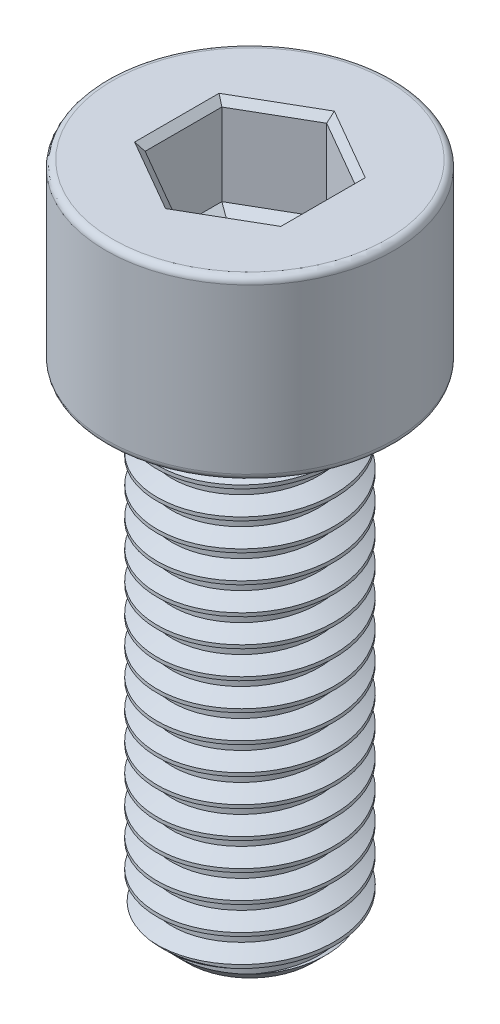
from build123d import *

# Parameters (mm, degrees)
SKETCH1_R           = 4
BOSS_EXTRUDE1_DEPTH = 22
THREAD1_PITCH       = 1.25
SKETCH2_R           = 6.5
BOSS_EXTRUDE2_DEPTH = 8
FILLET1_R           = 0.3
CUT_EXTRUDE1_DEPTH  = 4
CHAMFER1_SIZE       = 0.3
CUT_EXTRUDE2_DEPTH  = 0.4
CUT_EXTRUDE2_DRAFT  = -60


with BuildPart() as part:
    # Sketch1 → Boss-Extrude1 (new body)
    with BuildSketch(Plane(origin=(0, 0, 0), x_dir=(1, 0, 0), z_dir=(0, 1, 0))):
        with Locations(Location((0, 0, 0), (0, 0, 270))):
            Circle(SKETCH1_R)
    extrude(amount=BOSS_EXTRUDE1_DEPTH)

    # Thread1: the profile of Thread Profile1 profile screwed along a right-hand helix of 18.6 turns, 8 arcs to a turn; built about Z, then put on its axis
    thread1_z = Axis((0, 0, 0), (0, 0, 1))
    thread1_corners = [(4.0003, 0, -0.000173205), (4.0003, 0, 1.093923202), (3.323417656, 0, 0.703124998), (3.323417656, 0, 0.390624998)]
    with BuildLine(mode=Mode.PRIVATE) as thread1_profile:
        Line(thread1_corners[0], thread1_corners[1])
        Line(thread1_corners[1], thread1_corners[2])
        Line(thread1_corners[2], thread1_corners[3])
        Line(thread1_corners[3], thread1_corners[0])
    thread1_cap = Face(thread1_profile.wire())
    thread1_turn_angles = [0, 22.5, 45, 67.5, 90, 112.5, 135, 157.5, 180, 202.5, 225, 247.5, 270, 292.5, 315, 337.5, 360]
    thread1_turn_weights = [1, 0.9238795325112867, 1, 0.9238795325112867, 1, 0.9238795325112867, 1, 0.9238795325112867, 1, 0.9238795325112867, 1, 0.9238795325112867, 1, 0.9238795325112867, 1, 0.9238795325112867, 1]
    thread1_turn_rails = [Edge.make_bspline([Vector(p[0], p[1], 0).rotate(thread1_z, thread1_turn_angles[k]) / thread1_turn_weights[k] + Vector(0, 0, p[2] + THREAD1_PITCH * thread1_turn_angles[k] / 360) for k in range(17)], [0, 0, 0, 1, 1, 2, 2, 3, 3, 4, 4, 5, 5, 6, 6, 7, 7, 8, 8, 8], 2, thread1_turn_weights) for p in thread1_corners]
    thread1_turn_sides = [Face.make_surface_from_curves(thread1_turn_rails[p[0]], thread1_turn_rails[p[1]]) for p in [(0, 1), (1, 2), (2, 3), (3, 0)]]
    thread1_last_angles = [6480, 6502.5, 6525, 6547.5, 6570, 6592.5, 6615, 6637.5, 6660, 6678, 6696]
    thread1_last_weights = [1, 0.9238795325112867, 1, 0.9238795325112867, 1, 0.9238795325112867, 1, 0.9238795325112867, 1, 0.9510565162951535, 1]
    thread1_last_rails = [Edge.make_bspline([Vector(p[0], p[1], 0).rotate(thread1_z, thread1_last_angles[k]) / thread1_last_weights[k] + Vector(0, 0, p[2] + THREAD1_PITCH * thread1_last_angles[k] / 360) for k in range(11)], [0, 0, 0, 1, 1, 2, 2, 3, 3, 4, 4, 5, 5, 5], 2, thread1_last_weights) for p in thread1_corners]
    thread1_last_sides = [Face.make_surface_from_curves(thread1_last_rails[p[0]], thread1_last_rails[p[1]]) for p in [(0, 1), (1, 2), (2, 3), (3, 0)]]
    thread1 = Plane(origin=(0, 23.25, 0), x_dir=(-1, 0, 0), z_dir=(0, -1, 0)) * Solid(Shell([*[p.moved(Location((0, 0, THREAD1_PITCH * i))) for i in range(18) for p in thread1_turn_sides], *thread1_last_sides, thread1_cap, thread1_cap.rotate(thread1_z, 6696).moved(Location((0, 0, THREAD1_PITCH * 6696 / 360)))]))
    add(thread1, mode=Mode.SUBTRACT)

    # Sketch2 → Boss-Extrude2 (add)
    with BuildSketch(Plane(origin=(0, 22, 0), x_dir=(1, 0, 0), z_dir=(0, 1, 0))):
        with Locations(Location((0, 0, 0), (0, 0, 270))):
            Circle(SKETCH2_R)
    extrude(amount=BOSS_EXTRUDE2_DEPTH)

    # Sketch5 → Cut-Revolve1 (revolve, cut)
    with BuildSketch(Plane.XY, mode=Mode.PRIVATE) as cut_revolve1_sk:
        Polygon((4.01, 0), (4.01, 1.2), (2.81, 0), align=None)
    revolve(cut_revolve1_sk.sketch.rotate(Axis((0, 0, 0), (0, 1, 0)), 261.496552413), axis=Axis((0, 0, 0), (0, 1, 0)), mode=Mode.SUBTRACT)

    # Fillet1
    fillet1_edges = [part.edges().sort_by_distance(p)[0] for p in [
        (0, 22, -6.5),
        (0, 30, -6.5),
    ]]
    fillet(fillet1_edges, radius=FILLET1_R)

    # Sketch6 → Cut-Extrude1 (cut)
    with BuildSketch(Plane(origin=(0, 30, 0), x_dir=(1, 0, 0), z_dir=(0, 1, 0))):
        Polygon((0, 3.464101615), (-3, 1.732050808), (-3, -1.732050808), (0, -3.464101615), (3, -1.732050808), (3, 1.732050808), align=None)
    extrude(amount=-CUT_EXTRUDE1_DEPTH, mode=Mode.SUBTRACT)

    # Chamfer1
    chamfer1_edges = [part.edges().sort_by_distance(p)[0] for p in [
        (1.5, 30, -2.598076211),
        (-1.5, 30, -2.598076211),
        (-3, 30, 0),
        (-1.5, 30, 2.598076211),
        (1.5, 30, 2.598076211),
        (3, 30, 0),
    ]]
    chamfer(chamfer1_edges, length=CHAMFER1_SIZE)


with BuildPart() as cut_extrude2_tool:
    # Sketch7 → Cut-Extrude2 (with draft: the straight prism first)
    with BuildSketch(Plane(origin=(0, 26, 0), x_dir=(1, 0, 0), z_dir=(0, 1, 0))):
        Polygon((0, 3.464101615), (-3, 1.732050808), (-3, -1.732050808), (0, -3.464101615), (3, -1.732050808), (3, 1.732050808), align=None)
    extrude(amount=-CUT_EXTRUDE2_DEPTH)
    # Cut-Extrude2: the draft: its side faces are tilted about the plane it starts from
    cut_extrude2_sides = [cut_extrude2_tool.faces().sort_by_distance(p)[0] for p in [
        (-1.5, 25.8, -2.598076211),
        (-3, 25.8, 0),
        (-1.5, 25.8, 2.598076211),
        (1.5, 25.8, 2.598076211),
        (3, 25.8, 0),
        (1.5, 25.8, -2.598076211),
    ]]
    draft(cut_extrude2_sides, Plane(origin=(0, 26, 0), x_dir=(1, 0, 0), z_dir=(0, 1, 0)), CUT_EXTRUDE2_DRAFT)


with BuildPart() as part_1:
    add(part.part)

    # Cut-Extrude2: cut by cut_extrude2_tool
    add(cut_extrude2_tool.part, mode=Mode.SUBTRACT)


solid = part_1.part
